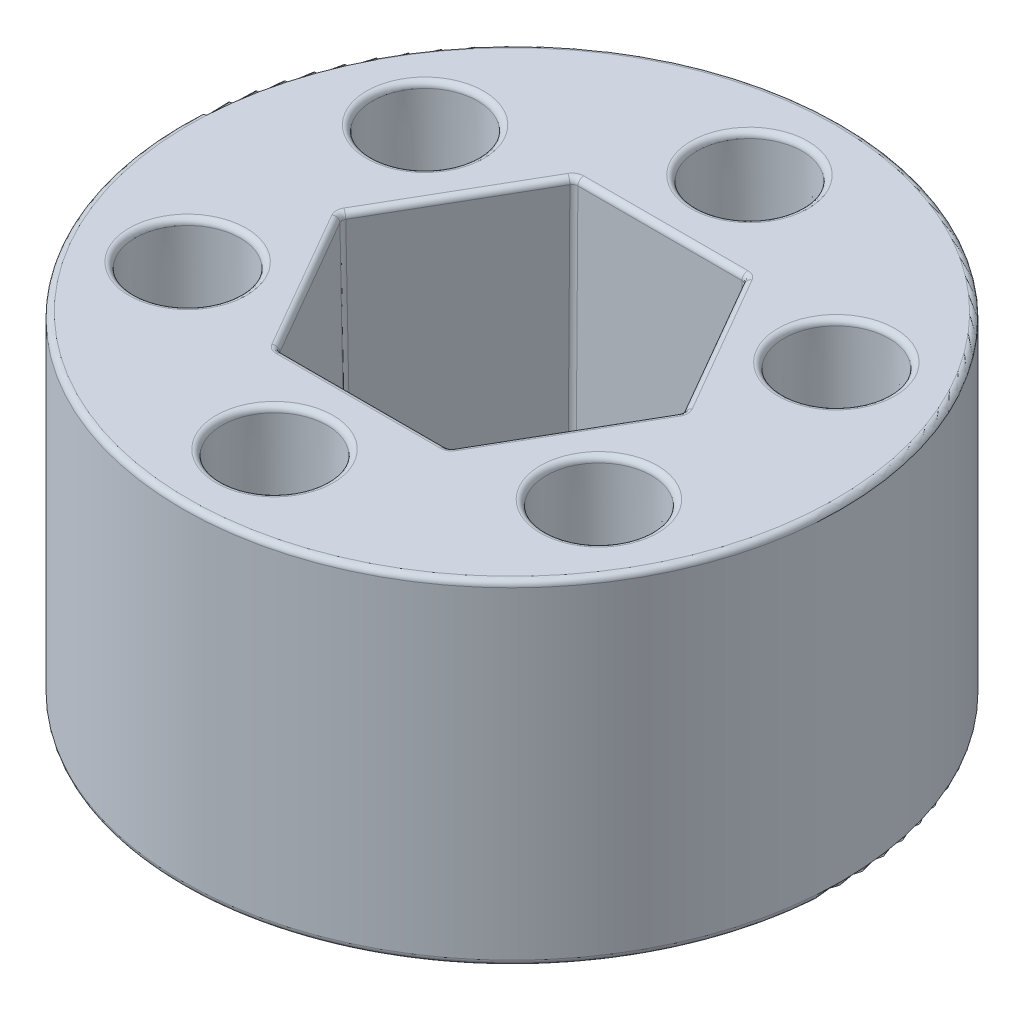
from build123d import *

# Parameters (mm, degrees)
SKETCH1_R                   = 14.2748
BOSS_EXTRUDE1_DEPTH         = 14.478
CUT_EXTRUDE1_DEPTH          = 14.478
CUT_EXTRUDE1_DRAFT          = -1
SKETCH3_R                   = 2.286
CUT_EXTRUDE2_DEPTH          = 14.478
CUT_EXTRUDE2_DRAFT          = -1
CIRPATTERN1_COPY_1_SKETCH_R = 2.286
CIRPATTERN1_COPY_1_DEPTH    = 14.478
CIRPATTERN1_COPY_1_DRAFT    = -1
CIRPATTERN1_COPY_2_SKETCH_R = 2.286
CIRPATTERN1_COPY_2_DEPTH    = 14.478
CIRPATTERN1_COPY_2_DRAFT    = -1
CIRPATTERN1_COPY_3_SKETCH_R = 2.286
CIRPATTERN1_COPY_3_DEPTH    = 14.478
CIRPATTERN1_COPY_3_DRAFT    = -1
CIRPATTERN1_COPY_4_SKETCH_R = 2.286
CIRPATTERN1_COPY_4_DEPTH    = 14.478
CIRPATTERN1_COPY_4_DRAFT    = -1
CIRPATTERN1_COPY_5_SKETCH_R = 2.286
CIRPATTERN1_COPY_5_DEPTH    = 14.478
CIRPATTERN1_COPY_5_DRAFT    = -1
VARFILLET1_R                = 0.254
FILLET2_R                   = 0.254


with BuildPart() as part:
    # Sketch1 → Boss-Extrude1 (new body)
    with BuildSketch(Plane(origin=(0, 0, 0), x_dir=(1, 0, 0), z_dir=(0, 1, 0))):
        Circle(SKETCH1_R)
    extrude(amount=BOSS_EXTRUDE1_DEPTH)


with BuildPart() as cut_extrude1_tool:
    # Sketch2 → Cut-Extrude1 (with draft: the straight prism first)
    with BuildSketch(Plane(origin=(0, 14.478, 0), x_dir=(-1, 0, 0), z_dir=(0, 1, 0))):
        Polygon((7.405671903, 0), (3.702835951, 6.4135), (-3.702835951, 6.4135), (-7.405671903, 0), (-3.702835951, -6.4135), (3.702835951, -6.4135), align=None)
    extrude(amount=-CUT_EXTRUDE1_DEPTH)
    # Cut-Extrude1: the draft: its side faces are tilted about the plane it starts from
    cut_extrude1_sides = [cut_extrude1_tool.faces().sort_by_distance(p)[0] for p in [
        (-5.554253927, 7.239, 3.20675),
        (0, 7.239, 6.4135),
        (5.554253927, 7.239, 3.20675),
        (5.554253927, 7.239, -3.20675),
        (0, 7.239, -6.4135),
        (-5.554253927, 7.239, -3.20675),
    ]]
    draft(cut_extrude1_sides, Plane(origin=(0, 14.478, 0), x_dir=(-1, 0, 0), z_dir=(0, 1, 0)), CUT_EXTRUDE1_DRAFT)


with BuildPart() as part_1:
    add(part.part)

    # Cut-Extrude1: cut by cut_extrude1_tool
    add(cut_extrude1_tool.part, mode=Mode.SUBTRACT)


with BuildPart() as cut_extrude2_tool:
    # Sketch3 → Cut-Extrude2 (with draft: the straight prism first)
    with BuildSketch(Plane(origin=(0, 14.478, 0), x_dir=(-1, 0, 0), z_dir=(0, 1, 0))):
        with Locations((-8.908803329, 5.1435)):
            Circle(SKETCH3_R)
    extrude(amount=-CUT_EXTRUDE2_DEPTH)
    # Cut-Extrude2: the draft: its side faces are tilted about the plane it starts from
    cut_extrude2_sides = [cut_extrude2_tool.faces().sort_by_distance(p)[0] for p in [
        (11.194803329, 7.239, 5.1435),
    ]]
    draft(cut_extrude2_sides, Plane(origin=(0, 14.478, 0), x_dir=(-1, 0, 0), z_dir=(0, 1, 0)), CUT_EXTRUDE2_DRAFT)


with BuildPart() as part_2:
    add(part_1.part)

    # Cut-Extrude2: cut by cut_extrude2_tool
    add(cut_extrude2_tool.part, mode=Mode.SUBTRACT)


with BuildPart() as cirpattern1_copy_1_tool:
    # CirPattern1 copy 1 sketch → CirPattern1 copy 1 (with draft: the straight prism first)
    with BuildSketch(Plane(origin=(0, 14.478, 0), x_dir=(-0.5000000000000001, 0, 0.8660254037844386), z_dir=(0, 1, 0))):
        with Locations((-8.908803329, 5.1435)):
            Circle(CIRPATTERN1_COPY_1_SKETCH_R)
    extrude(amount=-CIRPATTERN1_COPY_1_DEPTH)
    # CirPattern1 copy 1: the draft: its side faces are tilted about the plane it starts from
    cirpattern1_copy_1_sides = [cirpattern1_copy_1_tool.faces().sort_by_distance(p)[0] for p in [
        (10.051803329, 7.239, -7.123234073),
    ]]
    draft(cirpattern1_copy_1_sides, Plane(origin=(0, 14.478, 0), x_dir=(-0.5000000000000001, 0, 0.8660254037844386), z_dir=(0, 1, 0)), CIRPATTERN1_COPY_1_DRAFT)


with BuildPart() as part_3:
    add(part_2.part)

    # CirPattern1 copy 1: cut by cirpattern1_copy_1_tool
    add(cirpattern1_copy_1_tool.part, mode=Mode.SUBTRACT)


with BuildPart() as cirpattern1_copy_2_tool:
    # CirPattern1 copy 2 sketch → CirPattern1 copy 2 (with draft: the straight prism first)
    with BuildSketch(Plane(origin=(0, 14.478, 0), x_dir=(0.4999999999999998, 0, 0.8660254037844387), z_dir=(0, 1, 0))):
        with Locations((-8.908803329, 5.1435)):
            Circle(CIRPATTERN1_COPY_2_SKETCH_R)
    extrude(amount=-CIRPATTERN1_COPY_2_DEPTH)
    # CirPattern1 copy 2: the draft: its side faces are tilted about the plane it starts from
    cirpattern1_copy_2_sides = [cirpattern1_copy_2_tool.faces().sort_by_distance(p)[0] for p in [
        (-1.143, 7.239, -12.266734073),
    ]]
    draft(cirpattern1_copy_2_sides, Plane(origin=(0, 14.478, 0), x_dir=(0.4999999999999998, 0, 0.8660254037844387), z_dir=(0, 1, 0)), CIRPATTERN1_COPY_2_DRAFT)


with BuildPart() as part_4:
    add(part_3.part)

    # CirPattern1 copy 2: cut by cirpattern1_copy_2_tool
    add(cirpattern1_copy_2_tool.part, mode=Mode.SUBTRACT)


with BuildPart() as cirpattern1_copy_3_tool:
    # CirPattern1 copy 3 sketch → CirPattern1 copy 3 (with draft: the straight prism first)
    with BuildSketch(Plane(origin=(0, 14.478, 0), x_dir=(1, 0, 0), z_dir=(0, 1, 0))):
        with Locations((-8.908803329, 5.1435)):
            Circle(CIRPATTERN1_COPY_3_SKETCH_R)
    extrude(amount=-CIRPATTERN1_COPY_3_DEPTH)
    # CirPattern1 copy 3: the draft: its side faces are tilted about the plane it starts from
    cirpattern1_copy_3_sides = [cirpattern1_copy_3_tool.faces().sort_by_distance(p)[0] for p in [
        (-11.194803329, 7.239, -5.1435),
    ]]
    draft(cirpattern1_copy_3_sides, Plane(origin=(0, 14.478, 0), x_dir=(1, 0, 0), z_dir=(0, 1, 0)), CIRPATTERN1_COPY_3_DRAFT)


with BuildPart() as part_5:
    add(part_4.part)

    # CirPattern1 copy 3: cut by cirpattern1_copy_3_tool
    add(cirpattern1_copy_3_tool.part, mode=Mode.SUBTRACT)


with BuildPart() as cirpattern1_copy_4_tool:
    # CirPattern1 copy 4 sketch → CirPattern1 copy 4 (with draft: the straight prism first)
    with BuildSketch(Plane(origin=(0, 14.478, 0), x_dir=(0.5000000000000004, 0, -0.8660254037844384), z_dir=(0, 1, 0))):
        with Locations((-8.908803329, 5.1435)):
            Circle(CIRPATTERN1_COPY_4_SKETCH_R)
    extrude(amount=-CIRPATTERN1_COPY_4_DEPTH)
    # CirPattern1 copy 4: the draft: its side faces are tilted about the plane it starts from
    cirpattern1_copy_4_sides = [cirpattern1_copy_4_tool.faces().sort_by_distance(p)[0] for p in [
        (-10.051803329, 7.239, 7.123234073),
    ]]
    draft(cirpattern1_copy_4_sides, Plane(origin=(0, 14.478, 0), x_dir=(0.5000000000000004, 0, -0.8660254037844384), z_dir=(0, 1, 0)), CIRPATTERN1_COPY_4_DRAFT)


with BuildPart() as part_6:
    add(part_5.part)

    # CirPattern1 copy 4: cut by cirpattern1_copy_4_tool
    add(cirpattern1_copy_4_tool.part, mode=Mode.SUBTRACT)


with BuildPart() as cirpattern1_copy_5_tool:
    # CirPattern1 copy 5 sketch → CirPattern1 copy 5 (with draft: the straight prism first)
    with BuildSketch(Plane(origin=(0, 14.478, 0), x_dir=(-0.5000000000000001, 0, -0.8660254037844386), z_dir=(0, 1, 0))):
        with Locations((-8.908803329, 5.1435)):
            Circle(CIRPATTERN1_COPY_5_SKETCH_R)
    extrude(amount=-CIRPATTERN1_COPY_5_DEPTH)
    # CirPattern1 copy 5: the draft: its side faces are tilted about the plane it starts from
    cirpattern1_copy_5_sides = [cirpattern1_copy_5_tool.faces().sort_by_distance(p)[0] for p in [
        (1.143, 7.239, 12.266734073),
    ]]
    draft(cirpattern1_copy_5_sides, Plane(origin=(0, 14.478, 0), x_dir=(-0.5000000000000001, 0, -0.8660254037844386), z_dir=(0, 1, 0)), CIRPATTERN1_COPY_5_DRAFT)


with BuildPart() as part_7:
    add(part_6.part)

    # CirPattern1 copy 5: cut by cirpattern1_copy_5_tool
    add(cirpattern1_copy_5_tool.part, mode=Mode.SUBTRACT)

    # VarFillet1
    varfillet1_edges = [part_7.edges().sort_by_distance(p)[0] for p in [
        (-3.629883579, 7.239, -6.287142785),
        (3.629883579, 7.239, -6.287142785),
        (7.259767159, 7.239, 0),
        (3.629883579, 7.239, 6.287142785),
        (-3.629883579, 7.239, 6.287142785),
        (-7.259767159, 7.239, 0),
    ]]
    fillet(varfillet1_edges, radius=VARFILLET1_R)

    # Fillet2
    fillet2_edges = [part_7.edges().sort_by_distance(p)[0] for p in [
        (-14.2748, 0, 0),
        (3.537287694, 0, -6.126762007),
        (5.335396811, 0, -3.080392785),
        (7.074575388, 0, 0),
        (5.335396811, 0, 3.080392785),
        (3.537287694, 0, 6.126762007),
        (0, 0, 6.16078557),
        (-3.537287694, 0, 6.126762007),
        (-5.335396811, 0, 3.080392785),
        (-7.074575388, 0, 0),
        (-5.335396811, 0, -3.080392785),
        (-3.537287694, 0, -6.126762007),
        (0, 0, -6.16078557),
        (10.942088899, 0, 5.1435),
        (1.016642785, 0, 12.047876957),
        (-9.925446114, 0, 6.904376957),
        (-10.942088899, 0, -5.1435),
        (-1.016642785, 0, -12.047876957),
        (9.925446114, 0, -6.904376957),
        (-14.2748, 14.478, 0),
        (-3.683192438, 14.478, 6.379476437),
        (0, 14.478, 6.4135),
        (3.683192438, 14.478, 6.379476437),
        (5.554253927, 14.478, 3.20675),
        (7.366384876, 14.478, 0),
        (5.554253927, 14.478, -3.20675),
        (3.683192438, 14.478, -6.379476437),
        (0, 14.478, -6.4135),
        (-3.683192438, 14.478, -6.379476437),
        (-5.554253927, 14.478, -3.20675),
        (-7.366384876, 14.478, 0),
        (-5.554253927, 14.478, 3.20675),
        (11.194803329, 14.478, 5.1435),
        (1.143, 14.478, 12.266734073),
        (-10.051803329, 14.478, 7.123234073),
        (-11.194803329, 14.478, -5.1435),
        (-1.143, 14.478, -12.266734073),
        (10.051803329, 14.478, -7.123234073),
    ]]
    fillet(fillet2_edges, radius=FILLET2_R)


solid = part_7.part
